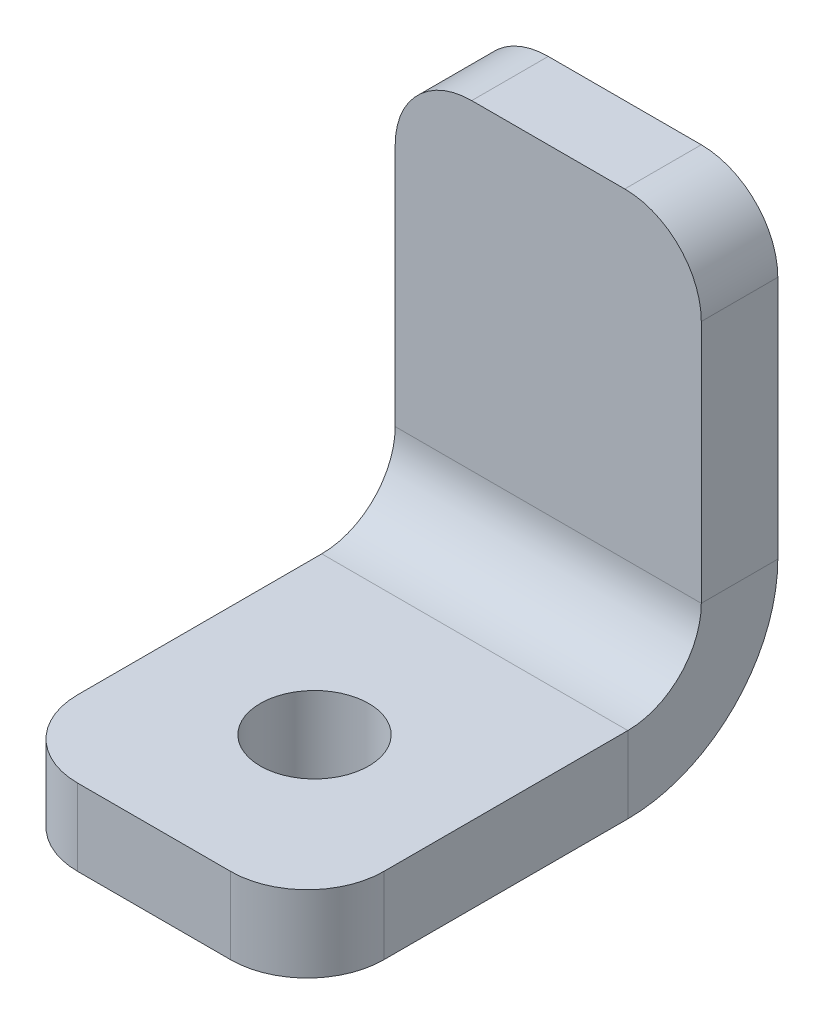
from build123d import *

# Parameters (mm, degrees)
SKETCH1_W                    = 12.7
SKETCH1_H                    = 19.525000066
BOSS_EXTRUDE1_DEPTH          = 3
CONVERT_SOLID2_START         = -0.175
CONVERT_SOLID2_OUTLINE_W     = 12.7
CONVERT_SOLID2_OUTLINE_H     = 19.525000066
CONVERT_SOLID2_DEPTH         = 0.175
EDGE_FLANGE1_STRIP_W         = 18.796
EDGE_FLANGE1_STRIP_H         = 3.175
EDGE_FLANGE1_STRIP_CUT_DEPTH = 12.7
EDGE_FLANGE1_DEPTH           = 12.7
M4_CLEARANCE_HOLE4_D         = 4.5
M4_CLEARANCE_HOLE4_DEPTH     = 16.002
M4_CLEARANCE_HOLE4_TIP       = 1.351936393
FILLET1_R                    = 3.175


# Read off the part's stored shape, not the designer's step: Convert-Solid2
# Sheet-metal steps are written as plain solids
with BuildPart() as part:
    # Sketch1 → Boss-Extrude1 (new body)
    with BuildSketch(Plane.XY):
        with Locations((6.35, 9.762500033)):
            Rectangle(SKETCH1_W, SKETCH1_H)
    extrude(amount=BOSS_EXTRUDE1_DEPTH)

    # Convert-Solid2 outline → Convert-Solid2 (add)
    with BuildSketch(Plane.XY.offset(CONVERT_SOLID2_START)):
        with Locations((6.35, 9.762500033)):
            Rectangle(CONVERT_SOLID2_OUTLINE_W, CONVERT_SOLID2_OUTLINE_H)
    extrude(amount=CONVERT_SOLID2_DEPTH)

    # Edge-Flange1 strip (across the edge) → Edge-Flange1 strip cut (cut)
    with BuildSketch(Plane(origin=(0, 0, 3), x_dir=(0, 1, 0), z_dir=(1, 0, 0))):
        with Locations((-3.175, -1.5875)):
            Rectangle(EDGE_FLANGE1_STRIP_W, EDGE_FLANGE1_STRIP_H)
    extrude(amount=EDGE_FLANGE1_STRIP_CUT_DEPTH, mode=Mode.SUBTRACT)

    # Edge-Flange1 section (across the edge) → Edge-Flange1 (add)
    with BuildSketch(Plane(origin=(0, 0, 3), x_dir=(0, 1, 0), z_dir=(1, 0, 0))):
        with BuildLine():
            Line((0, 3.048), (0, 16.350000066))
            Line((0, 16.350000066), (3.175, 16.350000066))
            Line((3.175, 16.350000066), (3.175, 3.048))
            ThreePointArc((3.175, 3.048), (4.067738531, 0.892738531), (6.223, 0))
            Line((6.223, 0), (6.223, -3.175))
            ThreePointArc((6.223, -3.175), (1.822674501, -1.352325499), (0, 3.048))
        make_face()
    extrude(amount=EDGE_FLANGE1_DEPTH)

    # M4 Clearance Hole4
    with Locations(Plane(origin=(0, 3.175, 0), x_dir=(1, 0, 0), z_dir=(0, 1, 0))):
        with Locations((6.35, -12.699000033)):
            Hole(M4_CLEARANCE_HOLE4_D / 2, depth=M4_CLEARANCE_HOLE4_DEPTH)
            with Locations((0, 0, -(M4_CLEARANCE_HOLE4_DEPTH + M4_CLEARANCE_HOLE4_TIP / 2))):  # 118° drill point
                Cone(0, M4_CLEARANCE_HOLE4_D / 2, M4_CLEARANCE_HOLE4_TIP, mode=Mode.SUBTRACT)

    # Fillet1
    fillet1_edges = [part.edges().sort_by_distance(p)[0] for p in [
        (0, 1.5875, 19.350000066),
        (12.7, 1.5875, 19.350000066),
        (0, 19.525000066, 1.4125),
        (12.7, 19.525000066, 1.4125),
    ]]
    fillet(fillet1_edges, radius=FILLET1_R)


solid = part.part
